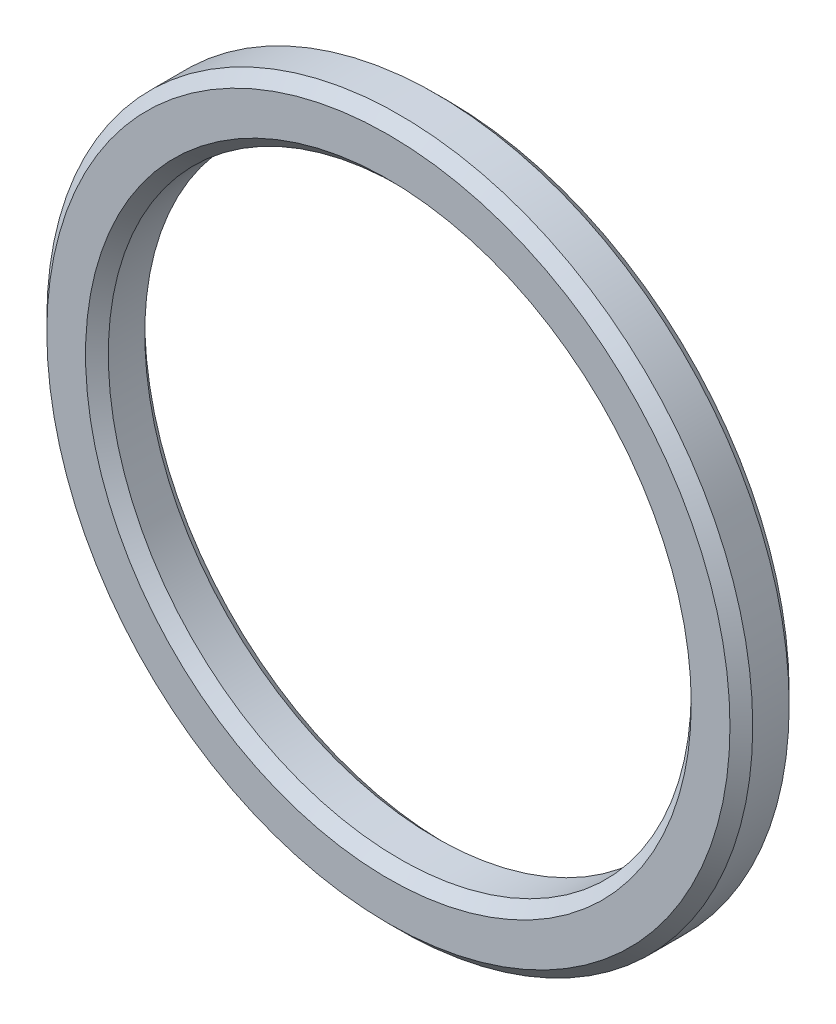
from build123d import *

# Parameters (mm, degrees)
SKETCH1_R           = 15.5
SKETCH1_R_2         = 12.8
BOSS_EXTRUDE1_DEPTH = 2.6
CHAMFER1_SIZE       = 0.5


with BuildPart() as part:
    # Sketch1 → Boss-Extrude1 (new body)
    with BuildSketch(Plane.XY):
        Circle(SKETCH1_R)
        Circle(SKETCH1_R_2, mode=Mode.SUBTRACT)
    extrude(amount=BOSS_EXTRUDE1_DEPTH)

    # Chamfer1
    chamfer1_edges = [part.edges().sort_by_distance(p)[0] for p in [
        (-12.8, 0, 0),
        (-15.5, 0, 0),
        (-12.8, 0, 2.6),
        (-15.5, 0, 2.6),
    ]]
    chamfer(chamfer1_edges, length=CHAMFER1_SIZE)


solid = part.part
